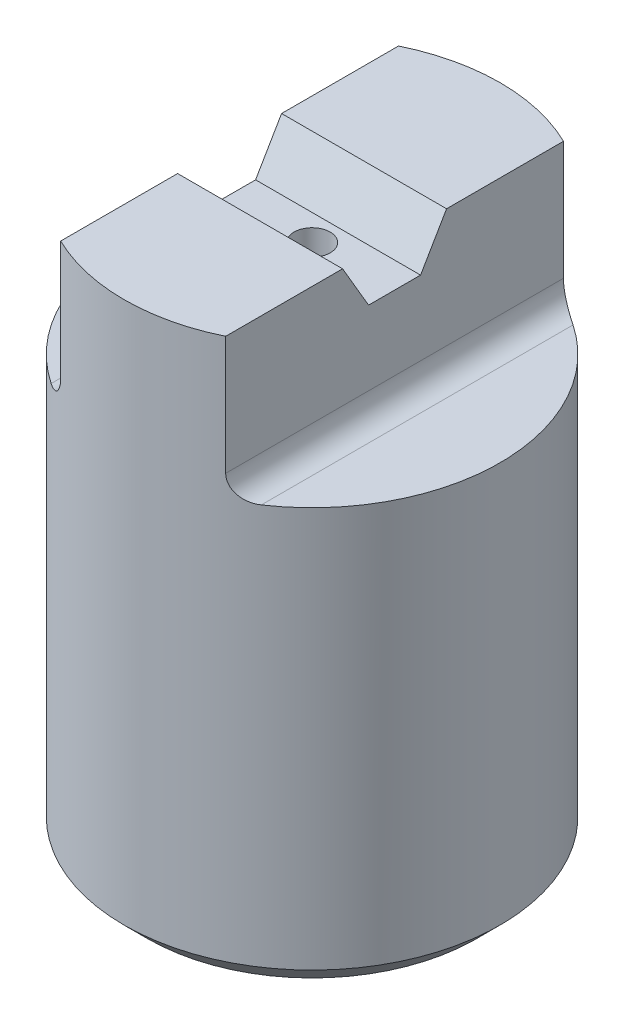
from build123d import *

# Parameters (mm, degrees)
CROQUIS1_R                  = 12.6746
SALIENTE_EXTRUIR2_DEPTH     = 28.575
SALIENTE_EXTRUIR3_DEPTH     = 9.525
CROQUIS6_W                  = 11.1252
CROQUIS6_H                  = 3.5052
CORTAR_EXTRUIR3_DEPTH       = 2.9972
REDONDEO2_R                 = 1.524
CORTAR_EXTRUIR9_DEPTH       = 45.100464428
CORTAR_EXTRUIR10_DEPTH      = 45.100464428
TALADRO_ROSCADO_8_326_D     = 3.4544
TALADRO_ROSCADO_8_326_DEPTH = 20.574
TALADRO_ROSCADO_8_326_TIP   = 1.037806461
CROQUIS40_R                 = 1.2192
CORTAR_EXTRUIR14_DEPTH      = 43.105830748
CORTAR_EXTRUIR15_DEPTH      = 0.0508


with BuildPart() as part:
    # Croquis1 → Saliente-Extruir2 (new body)
    with BuildSketch(Plane(origin=(0, 0, 0), x_dir=(1, 0, 0), z_dir=(0, 1, 0))):
        with Locations(Location((0, 0, 0), (0, 0, 270))):
            Circle(CROQUIS1_R)
    extrude(amount=SALIENTE_EXTRUIR2_DEPTH)

    # Croquis5 → Saliente-Extruir3 (add)
    with BuildSketch(Plane(origin=(0, 28.575, 0), x_dir=(1, 0, 0), z_dir=(0, 1, 0))):
        with BuildLine():
            ThreePointArc((5.5626, 11.388721017), (2.854645491, 12.348946687), (0, 12.6746))
            ThreePointArc((0, 12.6746), (-2.854645491, 12.348946687), (-5.5626, 11.388721017))
            Line((-5.5626, 11.388721017), (-5.5626, -11.388721017))
            ThreePointArc((-5.5626, -11.388721017), (-2.854645491, -12.348946687), (0, -12.6746))
            ThreePointArc((0, -12.6746), (2.854645491, -12.348946687), (5.5626, -11.388721017))
            Line((5.5626, -11.388721017), (5.5626, 11.388721017))
        make_face()
    extrude(amount=SALIENTE_EXTRUIR3_DEPTH)

    # Croquis6 → Cortar-Extruir3 (cut)
    with BuildSketch(Plane(origin=(0, 38.1, 0), x_dir=(1, 0, 0), z_dir=(0, 1, 0))):
        Rectangle(CROQUIS6_W, CROQUIS6_H)
    extrude(amount=-CORTAR_EXTRUIR3_DEPTH, mode=Mode.SUBTRACT)

    # Redondeo2
    # the kernel refuses this fillet: 1.524 mm, written as the material it adds along each edge
    with BuildSketch(Plane(origin=(5.5626, 28.575, 15.198721017), x_dir=(0, 1, 0), z_dir=(0, 0, -1))) as redondeo2_piece_1_section:
        with BuildLine():
            CenterArc((REDONDEO2_R, REDONDEO2_R), REDONDEO2_R, 180, 90)
            Line((0, REDONDEO2_R), (0, 0))
            Line((0, 0), (REDONDEO2_R, 0))
        make_face()
    redondeo2_piece_1 = extrude(amount=30.397442034, mode=Mode.PRIVATE)
    redondeo2_piece_1 = redondeo2_piece_1 & Plane(origin=(0, 28.923095932, 0), x_dir=(0, 0, 1), z_dir=(0, -1, 0)) * Cylinder(12.6746, 67, mode=Mode.PRIVATE)
    add(redondeo2_piece_1)
    with BuildSketch(Plane(origin=(-5.5626, 28.575, -15.198721017), x_dir=(0, 1, 0), z_dir=(0, 0, 1))) as redondeo2_piece_2_section:
        with BuildLine():
            CenterArc((REDONDEO2_R, REDONDEO2_R), REDONDEO2_R, 180, 90)
            Line((0, REDONDEO2_R), (0, 0))
            Line((0, 0), (REDONDEO2_R, 0))
        make_face()
    redondeo2_piece_2 = extrude(amount=30.397442034, mode=Mode.PRIVATE)
    redondeo2_piece_2 = redondeo2_piece_2 & Plane(origin=(0, 28.923095728, 0), x_dir=(0, 0, 1), z_dir=(0, -1, 0)) * Cylinder(12.6746, 67, mode=Mode.PRIVATE)
    add(redondeo2_piece_2)

    # Chaflán1
    # the kernel refuses this chamfer: 1.5748 mm, written as the material it takes off along each edge
    with BuildSketch(Plane(origin=(0, 0, 0), x_dir=(0, 0, 1), z_dir=(-1, 0, 0))) as chafl_n1_piece_1:
        with BuildLine():
            Line((12.71914207, 1.61934207), (11.05525793, -0.04454207))
            Line((11.05525793, -0.04454207), (11.05525793, -0.07603807))
            ThreePointArc((11.05525793, -0.07603807), (11.864928965, -0.031496), (12.6746, -0.031496))
            Line((12.6746, -0.031496), (12.706096, 0))
            ThreePointArc((12.706096, 0), (12.706096, 0.809671035), (12.75063807, 1.61934207))
            Line((12.75063807, 1.61934207), (12.71914207, 1.61934207))
        make_face()
    revolve(axis=Axis((0, 0, 0), (0, 1, 0)), mode=Mode.SUBTRACT)

    # Croquis15 → Cortar-Extruir9 (cut, through all)
    with BuildSketch(Plane(origin=(5.5626, 0, 0), x_dir=(0, 0, -1), z_dir=(1, 0, 0))):
        Polygon((-1.7526, 38.1), (-3.5052, 38.1), (-1.7526, 35.1028), align=None)
    extrude(amount=-CORTAR_EXTRUIR9_DEPTH, mode=Mode.SUBTRACT)

    # Croquis16 → Cortar-Extruir10 (cut, through all)
    with BuildSketch(Plane(origin=(5.5626, 0, 0), x_dir=(0, 0, -1), z_dir=(1, 0, 0))):
        Polygon((1.7526, 38.1), (3.5052, 38.1), (1.7526, 35.1028), align=None)
    extrude(amount=-CORTAR_EXTRUIR10_DEPTH, mode=Mode.SUBTRACT)

    # Taladro roscado #8-326
    with Locations(Plane(origin=(0, 0, 0), x_dir=(-1, 0, 0), z_dir=(0, -1, 0))):
        with Locations((0, 0)):
            Hole(TALADRO_ROSCADO_8_326_D / 2, depth=TALADRO_ROSCADO_8_326_DEPTH)
            with Locations((0, 0, -(TALADRO_ROSCADO_8_326_DEPTH + TALADRO_ROSCADO_8_326_TIP / 2))):  # 118° drill point
                Cone(0, TALADRO_ROSCADO_8_326_D / 2, TALADRO_ROSCADO_8_326_TIP, mode=Mode.SUBTRACT)

    # Croquis40 → Cortar-Extruir14 (cut, through all)
    with BuildSketch(Plane(origin=(0, 0, 0), x_dir=(-1, 0, 0), z_dir=(0, -1, 0))):
        with Locations(Location((0, 0, 0), (0, 0, 90))):
            Circle(CROQUIS40_R)
    extrude(amount=-CORTAR_EXTRUIR14_DEPTH, mode=Mode.SUBTRACT)

    # Croquis41 → Cortar-Extruir15 (cut)
    # profile 1 of 6: a face of its own
    with BuildSketch(Plane.XZ):
        with BuildLine():
            Line((-4.992662026, -3.293411408), (-4.768303051, -3.293411408))
            Line((-4.768303051, -3.293411408), (-4.768303051, -5.390466696))
            add(Edge.make_bspline(
                [(-4.768303051, -5.390466696), (-4.768386411, -5.420148045), (-4.768544599, -5.476473518), (-4.767488008, -5.556630617), (-4.767313328, -5.627924481), (-4.765166457, -5.690534847), (-4.765388336, -5.744330476), (-4.762801871, -5.789411743), (-4.760954184, -5.825653774), (-4.759227779, -5.846899537), (-4.758487346, -5.856011568)],
                knots=[0, 0, 0, 0, 1.52940598, 2.902311409, 4.130712251, 5.202771279, 6.130127115, 6.901697667, 7.528952418, 8, 8, 8, 8], degree=3))
            add(Edge.make_bspline(
                [(-4.758487346, -5.856011568), (-4.755056742, -5.88880782), (-4.748425029, -5.952206373), (-4.7300757, -6.042465908), (-4.70641213, -6.124748397), (-4.676422048, -6.199112019), (-4.638457609, -6.266635032), (-4.592132999, -6.328122409), (-4.535635619, -6.382849035), (-4.473060827, -6.432214804), (-4.405232741, -6.472227698), (-4.335984491, -6.50245132), (-4.266087847, -6.520897884), (-4.219192787, -6.523100238), (-4.196187667, -6.524180638)],
                knots=[0, 0, 0, 0, 1.233978422, 2.385408102, 3.443092075, 4.435883103, 5.380097978, 6.335597085, 7.306989159, 8.316906446, 9.313315333, 10.246232584, 11.139661392, 12, 12, 12, 12], degree=3))
            add(Edge.make_bspline(
                [(-4.196187667, -6.524180638), (-4.176264914, -6.523091954), (-4.136224529, -6.520903936), (-4.07680775, -6.507583995), (-4.019515335, -6.483361432), (-3.963128624, -6.452209128), (-3.910669392, -6.41138045), (-3.861384756, -6.3641374), (-3.818275035, -6.308809383), (-3.77878774, -6.24737984), (-3.743237988, -6.17913208), (-3.714890605, -6.1031862), (-3.688547019, -6.021353301), (-3.677011991, -5.963665416), (-3.671047443, -5.933836087)],
                knots=[0, 0, 0, 0, 0.837480519, 1.683153013, 2.542005906, 3.443313479, 4.382087717, 5.32649414, 6.304899784, 7.320870994, 8.392453742, 9.530326583, 10.722977969, 12, 12, 12, 12], degree=3))
            add(Edge.make_bspline(
                [(-3.671047443, -5.933836087), (-3.669065145, -5.921464707), (-3.664628284, -5.893774578), (-3.660072207, -5.847421191), (-3.655960873, -5.792483488), (-3.652478995, -5.7289004), (-3.649805715, -5.656674316), (-3.647492588, -5.575576925), (-3.64728677, -5.485817851), (-3.646775343, -5.423185178), (-3.64650818, -5.390466696)],
                knots=[0, 0, 0, 0, 0.552253263, 1.236075838, 2.05236972, 2.981084083, 4.043109589, 5.238675865, 6.557520693, 8, 8, 8, 8], degree=3))
            Line((-3.64650818, -5.390466696), (-3.64650818, -3.293411408))
            Line((-3.64650818, -3.293411408), (-3.422149205, -3.293411408))
            Line((-3.422149205, -3.293411408), (-3.422149205, -5.407293619))
            add(Edge.make_bspline(
                [(-3.422149205, -5.407293619), (-3.422145618, -5.44539169), (-3.422138617, -5.51973615), (-3.426101895, -5.628647334), (-3.430953151, -5.731950993), (-3.436718314, -5.829749521), (-3.446287171, -5.921547425), (-3.456501645, -6.008111089), (-3.468987609, -6.089054706), (-3.488259512, -6.188389008), (-3.51985986, -6.305238476), (-3.574075113, -6.436959154), (-3.64504873, -6.558943511), (-3.7155395, -6.65239644), (-3.779060793, -6.719401818), (-3.829714099, -6.762876108), (-3.882291486, -6.800380023), (-3.937465853, -6.83100541), (-3.995521465, -6.854105318), (-4.055871834, -6.871076453), (-4.118969258, -6.881041764), (-4.161797882, -6.882442838), (-4.183567475, -6.883154997)],
                knots=[0, 0, 0, 0, 1.238879896, 2.417546473, 3.543655311, 4.602315735, 5.602851712, 6.544620291, 7.436811699, 8.265563253, 9.834735862, 11.364748224, 12.883467989, 14.412706183, 15.159901872, 15.882054845, 16.580046493, 17.256989577, 17.928793198, 18.607398226, 19.292146902, 20, 20, 20, 20], degree=3))
            add(Edge.make_bspline(
                [(-4.183567475, -6.883154997), (-4.206958879, -6.88235663), (-4.253214246, -6.880777898), (-4.321491122, -6.871991675), (-4.386970123, -6.855204574), (-4.450573247, -6.834041035), (-4.51074344, -6.804644127), (-4.569034859, -6.770479059), (-4.62345849, -6.728369544), (-4.676218004, -6.681758421), (-4.724947655, -6.62913737), (-4.769982839, -6.57219038), (-4.81077525, -6.510979532), (-4.846991367, -6.445659584), (-4.879908637, -6.376627176), (-4.906430232, -6.302792338), (-4.93094096, -6.225559218), (-4.94303647, -6.172087936), (-4.949192475, -6.144873747)],
                knots=[0, 0, 0, 0, 0.971014046, 1.9201332, 2.849222265, 3.772370379, 4.696333185, 5.62273577, 6.571210597, 7.546525356, 8.541459588, 9.542613398, 10.556648516, 11.58997757, 12.639875616, 13.726141058, 14.84272035, 16, 16, 16, 16], degree=3))
            add(Edge.make_bspline(
                [(-4.949192475, -6.144873747), (-4.952953823, -6.126217873), (-4.961140154, -6.08561457), (-4.968532993, -6.018733589), (-4.976803544, -5.941923421), (-4.981666395, -5.854629391), (-4.986880925, -5.757431147), (-4.990178645, -5.649899902), (-4.992311899, -5.532102343), (-4.992542044, -5.450063204), (-4.992662026, -5.407293619)],
                knots=[0, 0, 0, 0, 0.617064475, 1.343000901, 2.181091511, 3.123113956, 4.178235311, 5.338777187, 6.612620808, 8, 8, 8, 8], degree=3))
            Line((-4.992662026, -5.407293619), (-4.992662026, -3.293411408))
        make_face()
    # profile 2 of 6: a face of its own
    with BuildSketch(Plane.XZ):
        Polygon((-3.063174846, -3.652385767), (-3.063174846, -3.293411408), (-1.761892795, -3.293411408), (-1.761892795, -3.652385767), (-2.300354334, -3.652385767), (-2.300354334, -6.793411408), (-2.524713308, -6.793411408), (-2.524713308, -3.652385767), align=None)
    # profile 3 of 6: a face of its own
    with BuildSketch(Plane.XZ):
        with BuildLine():
            Line((-1.268303051, -4.370334485), (-1.492662026, -4.370334485))
            add(Edge.make_bspline(
                [(-1.492662026, -4.370334485), (-1.491249415, -4.328709553), (-1.48848232, -4.247172488), (-1.476698993, -4.127921677), (-1.457543571, -4.014412082), (-1.432613571, -3.906583036), (-1.400974668, -3.80409038), (-1.362572357, -3.707468663), (-1.317441044, -3.616551104), (-1.266690621, -3.531857638), (-1.210443491, -3.4554502), (-1.150844606, -3.388226925), (-1.087899902, -3.331437802), (-1.021800588, -3.284486071), (-0.951742259, -3.248633159), (-0.878841186, -3.222197529), (-0.802512309, -3.206290005), (-0.750481781, -3.204547105), (-0.724232539, -3.203667818)],
                knots=[0, 0, 0, 0, 1.297044685, 2.540718129, 3.729070834, 4.880324332, 5.985502297, 7.066906567, 8.115168262, 9.143861263, 10.138268346, 11.066215908, 11.937346821, 12.773434982, 13.584102209, 14.380791367, 15.183114186, 16, 16, 16, 16], degree=3))
            add(Edge.make_bspline(
                [(-0.724232539, -3.203667818), (-0.698209547, -3.204542868), (-0.647132483, -3.206260388), (-0.57273976, -3.221857793), (-0.501624691, -3.245376516), (-0.434913088, -3.280335692), (-0.371759033, -3.324355215), (-0.312606254, -3.378047283), (-0.257785827, -3.44193545), (-0.207409473, -3.514370967), (-0.16159378, -3.592978513), (-0.121234361, -3.676100948), (-0.08812935, -3.763132571), (-0.059411478, -3.853023745), (-0.038850729, -3.946777118), (-0.023523365, -4.043692817), (-0.01306459, -4.14411241), (-0.012287275, -4.212321568), (-0.011892795, -4.246937049)],
                knots=[0, 0, 0, 0, 0.891761707, 1.750320298, 2.597193173, 3.454252882, 4.323933789, 5.23219579, 6.187107746, 7.205893807, 8.255144488, 9.305864623, 10.371982191, 11.447226411, 12.54040718, 13.66085814, 14.812908365, 16, 16, 16, 16], degree=3))
            add(Edge.make_bspline(
                [(-0.011892795, -4.246937049), (-0.012817305, -4.29561094), (-0.014646394, -4.391909407), (-0.033835804, -4.533757316), (-0.063009006, -4.671298497), (-0.097864153, -4.783467214), (-0.133655696, -4.873754666), (-0.165367856, -4.947326513), (-0.203308608, -5.026230509), (-0.247231634, -5.110961853), (-0.294926044, -5.202290985), (-0.35053538, -5.298055307), (-0.409530423, -5.40082302), (-0.452461982, -5.470281345), (-0.47463318, -5.506151792)],
                knots=[0, 0, 0, 0, 1.28611077, 2.544495465, 3.77696322, 5.000306008, 5.643984437, 6.344138279, 7.117951803, 7.957999182, 8.867353859, 9.841408822, 10.885236111, 12, 12, 12, 12], degree=3))
            Line((-0.47463318, -5.506151792), (-1.054460904, -6.434437049))
            Line((-1.054460904, -6.434437049), (0.032979, -6.434437049))
            Line((0.032979, -6.434437049), (0.032979, -6.793411408))
            Line((0.032979, -6.793411408), (-1.582405616, -6.793411408))
            Line((-1.582405616, -6.793411408), (-0.677257378, -5.344893779))
            add(Edge.make_bspline(
                [(-0.677257378, -5.344893779), (-0.655172914, -5.310377804), (-0.612673104, -5.243954534), (-0.553216932, -5.146959205), (-0.499024331, -5.057468712), (-0.451184706, -4.974437499), (-0.409356518, -4.898464623), (-0.373010997, -4.829545011), (-0.343751073, -4.767126648), (-0.311675423, -4.693602158), (-0.280782085, -4.604391412), (-0.254939808, -4.496136477), (-0.238816495, -4.385077693), (-0.237113083, -4.310092791), (-0.236251769, -4.272177433)],
                knots=[0, 0, 0, 0, 1.252259667, 2.409874896, 3.476769317, 4.449496393, 5.338169355, 6.127231762, 6.830129708, 7.444415217, 8.578321592, 9.709547945, 10.841856079, 12, 12, 12, 12], degree=3))
            add(Edge.make_bspline(
                [(-0.236251769, -4.272177433), (-0.236571083, -4.248318482), (-0.237198647, -4.201427152), (-0.244652469, -4.132597353), (-0.255546455, -4.066188424), (-0.271975767, -4.002322496), (-0.291986039, -3.940801545), (-0.316800398, -3.881912397), (-0.346362636, -3.825627573), (-0.380267376, -3.772494039), (-0.417051494, -3.72348066), (-0.456199915, -3.680676294), (-0.497288897, -3.64403349), (-0.540901234, -3.61482514), (-0.586198647, -3.590774364), (-0.634159981, -3.575101246), (-0.683824755, -3.564700448), (-0.717635349, -3.563333891), (-0.734749366, -3.562642177)],
                knots=[0, 0, 0, 0, 1.195946325, 2.350460179, 3.467975454, 4.568023639, 5.653933819, 6.709635605, 7.768585112, 8.838246342, 9.867263882, 10.837753356, 11.742920911, 12.620583845, 13.464497734, 14.305803424, 15.142443115, 16, 16, 16, 16], degree=3))
            add(Edge.make_bspline(
                [(-0.734749366, -3.562642177), (-0.752784309, -3.563368062), (-0.788421919, -3.564802433), (-0.840668399, -3.574634746), (-0.890265244, -3.591858665), (-0.937591645, -3.615198666), (-0.982902713, -3.644960927), (-1.025877045, -3.681602152), (-1.065661734, -3.725673908), (-1.103525209, -3.775191471), (-1.137810734, -3.830951352), (-1.168780797, -3.89205452), (-1.19523593, -3.958779315), (-1.217531928, -4.030821731), (-1.236638652, -4.108020499), (-1.250828291, -4.190787664), (-1.262496757, -4.278698079), (-1.266331375, -4.339216979), (-1.268303051, -4.370334485)],
                knots=[0, 0, 0, 0, 0.810378014, 1.601332232, 2.378500311, 3.162873048, 3.966828608, 4.808649696, 5.693150465, 6.629974261, 7.60629017, 8.630194302, 9.704767081, 10.827479045, 12.017020653, 13.275760701, 14.599255253, 16, 16, 16, 16], degree=3))
        make_face()
    # profile 4 of 6: a face of its own
    with BuildSketch(Plane.XZ):
        with BuildLine():
            add(Edge.make_bspline(
                [(0.257337974, -5.044813651), (0.25751588, -4.988719007), (0.257861389, -4.87977841), (0.263139742, -4.721070025), (0.270337847, -4.572115557), (0.281708481, -4.433029668), (0.295590095, -4.30395689), (0.312100725, -4.184603362), (0.332219221, -4.075058212), (0.356219641, -3.974750975), (0.383311598, -3.882318426), (0.411561519, -3.795960636), (0.443500662, -3.715588001), (0.477329378, -3.640622198), (0.514884698, -3.5718501), (0.553671735, -3.50830757), (0.596372038, -3.451439347), (0.640037626, -3.399342379), (0.686670897, -3.353506267), (0.734833361, -3.313748308), (0.784222016, -3.279288145), (0.835609245, -3.252328032), (0.887704531, -3.229991685), (0.941391026, -3.214620213), (0.996444261, -3.205095648), (1.033674975, -3.204145798), (1.05241009, -3.203667818)],
                knots=[0, 0, 0, 0, 1.840611924, 3.574625809, 5.210288994, 6.733690746, 8.153088898, 9.469738415, 10.686590807, 11.806362567, 12.852408481, 13.84671381, 14.786621783, 15.689150017, 16.543575688, 17.356484395, 18.129528257, 18.874838159, 19.585241281, 20.271601602, 20.922514328, 21.557232885, 22.17251978, 22.77928835, 23.385717578, 24, 24, 24, 24], degree=3))
            add(Edge.make_bspline(
                [(1.05241009, -3.203667818), (1.071377234, -3.204148623), (1.109069173, -3.205104089), (1.164836676, -3.214586007), (1.219361714, -3.230167809), (1.272414117, -3.251945044), (1.324204921, -3.279508148), (1.374161036, -3.313732597), (1.423344605, -3.353432542), (1.470024877, -3.400325704), (1.516265246, -3.452001715), (1.55840441, -3.51137143), (1.599271062, -3.57576602), (1.637311577, -3.646587745), (1.672624806, -3.723574276), (1.706556701, -3.806453767), (1.73722362, -3.895690937), (1.76532749, -3.991367231), (1.790509585, -4.09430737), (1.81324814, -4.205055445), (1.830803204, -4.32452442), (1.846436378, -4.452130021), (1.858247611, -4.588469726), (1.866188484, -4.733212317), (1.872382597, -4.886307513), (1.872607276, -4.991054114), (1.87272259, -5.044813651)],
                knots=[0, 0, 0, 0, 0.61931987, 1.230726449, 1.842276086, 2.469083849, 3.101126489, 3.755607413, 4.444978797, 5.163186422, 5.915344883, 6.708120043, 7.538652771, 8.406543624, 9.332465898, 10.305288366, 11.331696478, 12.414266268, 13.562606502, 14.793690034, 16.107010801, 17.506992722, 18.994173924, 20.577607932, 22.243511351, 24, 24, 24, 24], degree=3))
            add(Edge.make_bspline(
                [(1.87272259, -5.044813651), (1.872600301, -5.098338932), (1.872362059, -5.202617197), (1.866266295, -5.355019424), (1.857984009, -5.499013325), (1.847346938, -5.634728866), (1.831543029, -5.761612642), (1.813621431, -5.880488328), (1.792213178, -5.990988722), (1.766714861, -6.093359103), (1.738510511, -6.188214081), (1.708508428, -6.27702139), (1.675532231, -6.359874832), (1.640051809, -6.437064451), (1.601397402, -6.507888004), (1.560681687, -6.572951928), (1.517302127, -6.631761828), (1.471769971, -6.684709167), (1.423767962, -6.730955933), (1.375153409, -6.771804317), (1.324559981, -6.80597468), (1.272908931, -6.833924147), (1.219699484, -6.856297846), (1.164951114, -6.871167001), (1.109155354, -6.881973837), (1.071392886, -6.882759868), (1.05241009, -6.883154997)],
                knots=[0, 0, 0, 0, 1.751203978, 3.411705794, 4.989635015, 6.470547094, 7.864820227, 9.172348517, 10.403592363, 11.546053707, 12.622745216, 13.64081562, 14.612090724, 15.539258073, 16.418683361, 17.250332895, 18.048691368, 18.807623264, 19.532264191, 20.2274163, 20.882777295, 21.526025529, 22.146602355, 22.76633056, 23.379847339, 24, 24, 24, 24], degree=3))
            add(Edge.make_bspline(
                [(1.05241009, -6.883154997), (1.033676694, -6.882672709), (0.996449398, -6.881714298), (0.941370777, -6.872253324), (0.887866643, -6.856664547), (0.835772035, -6.835422159), (0.784633039, -6.808798772), (0.735809604, -6.774656381), (0.688011402, -6.735242916), (0.64148994, -6.690285189), (0.597490078, -6.639053655), (0.555936475, -6.581735979), (0.516694711, -6.518411778), (0.479871414, -6.449252173), (0.445171792, -6.374459763), (0.413925453, -6.29348534), (0.384472903, -6.206764877), (0.35771383, -6.113440139), (0.333563132, -6.012475081), (0.313677956, -5.902155127), (0.296300756, -5.782412528), (0.281549459, -5.653368027), (0.270389167, -5.514702849), (0.263123571, -5.366455725), (0.257872712, -5.208680015), (0.2575195, -5.100440728), (0.257337974, -5.044813651)],
                knots=[0, 0, 0, 0, 0.615040495, 1.222218104, 1.829735474, 2.442855763, 3.067974884, 3.719690887, 4.39608901, 5.102002169, 5.842401988, 6.611854182, 7.425766082, 8.28800789, 9.184674408, 10.132888609, 11.13814523, 12.192858638, 13.321481046, 14.547385015, 15.874351835, 17.296351847, 18.813980256, 20.44399383, 22.172472907, 24, 24, 24, 24], degree=3))
        make_face()
        with BuildLine():
            add(Edge.make_bspline(
                [(0.481696949, -5.043411408), (0.482080465, -5.090153658), (0.482824551, -5.18084137), (0.485284048, -5.312689585), (0.49066077, -5.435680733), (0.499454256, -5.549701042), (0.508974712, -5.654942304), (0.52052191, -5.751608412), (0.535241457, -5.839303965), (0.557105426, -5.941794243), (0.589529079, -6.056130948), (0.637425005, -6.178825013), (0.694706469, -6.283501628), (0.76003588, -6.369927239), (0.83055099, -6.43797079), (0.904383194, -6.486775747), (0.980817188, -6.518308419), (1.033435968, -6.522239371), (1.059421307, -6.524180638)],
                knots=[0, 0, 0, 0, 1.299996472, 2.52220861, 3.667329456, 4.723158737, 5.702344579, 6.606077473, 7.429920264, 8.174407715, 9.519852493, 10.730430039, 11.830159776, 12.827237725, 13.732931806, 14.540564911, 15.279270345, 16, 16, 16, 16], degree=3))
            add(Edge.make_bspline(
                [(1.059421307, -6.524180638), (1.085406166, -6.522506834), (1.138272194, -6.519101489), (1.214343992, -6.487784102), (1.28758995, -6.440157054), (1.343801729, -6.38594601), (1.386308534, -6.333819744), (1.418547842, -6.289728058), (1.446471977, -6.239461576), (1.474275405, -6.185828783), (1.498581032, -6.126726862), (1.521821784, -6.063505613), (1.541918758, -5.994949761), (1.553869316, -5.947664766), (1.560022269, -5.92331926)],
                knots=[0, 0, 0, 0, 1.109016766, 2.256287439, 3.472688268, 4.83954039, 5.579231321, 6.354392292, 7.175278167, 8.039473, 8.941357723, 9.910535225, 10.924202583, 12, 12, 12, 12], degree=3))
            add(Edge.make_bspline(
                [(1.560022269, -5.92331926), (1.567345783, -5.892066827), (1.582254008, -5.828447329), (1.599142653, -5.729773866), (1.614737803, -5.626973847), (1.627552583, -5.519442715), (1.63612699, -5.407133688), (1.643378311, -5.290049325), (1.647569729, -5.168241744), (1.648096059, -5.085481748), (1.648363615, -5.043411408)],
                knots=[0, 0, 0, 0, 0.868982443, 1.768957519, 2.709576121, 3.684481657, 4.700344323, 5.759061376, 6.860837897, 8, 8, 8, 8], degree=3))
            add(Edge.make_bspline(
                [(1.648363615, -5.043411408), (1.648033549, -5.001342698), (1.647387971, -4.919060499), (1.644135903, -4.79865063), (1.637567958, -4.684130682), (1.629548871, -4.575367033), (1.618129774, -4.472537568), (1.605143453, -4.375415643), (1.588859409, -4.284271606), (1.570747377, -4.198654023), (1.550610033, -4.118833029), (1.528087462, -4.04467301), (1.503465782, -3.976248246), (1.478090055, -3.91255796), (1.448811878, -3.855543142), (1.419900952, -3.802775216), (1.387415448, -3.756687203), (1.343738706, -3.703684508), (1.286413403, -3.64911283), (1.214037121, -3.598853666), (1.137344288, -3.568854876), (1.085130448, -3.564691934), (1.059421307, -3.562642177)],
                knots=[0, 0, 0, 0, 1.462853938, 2.861196328, 4.18782769, 5.451198954, 6.652844536, 7.784875945, 8.857723185, 9.87141619, 10.827338558, 11.719363824, 12.565023905, 13.355800326, 14.100824753, 14.792290922, 15.44605478, 16.057864784, 17.178757343, 18.186242339, 19.106938872, 20, 20, 20, 20], degree=3))
            add(Edge.make_bspline(
                [(1.059421307, -3.562642177), (1.033478289, -3.564688958), (0.980809686, -3.568844262), (0.903462116, -3.598849847), (0.830344231, -3.648850984), (0.76009185, -3.716341622), (0.694224255, -3.801611625), (0.639380309, -3.907225257), (0.589841028, -4.029018994), (0.557893743, -4.143656785), (0.535871551, -4.246103262), (0.521517208, -4.333646931), (0.508593607, -4.430167161), (0.499556707, -4.535733293), (0.490684011, -4.649972863), (0.485255913, -4.773198011), (0.482830361, -4.905280412), (0.482082402, -4.996435466), (0.481696949, -5.043411408)],
                knots=[0, 0, 0, 0, 0.720594395, 1.462925345, 2.273981384, 3.170318304, 4.162048865, 5.255332532, 6.468105352, 7.81329763, 8.557645363, 9.381333542, 10.279270897, 11.264743477, 12.326855401, 13.465269645, 14.693749385, 16, 16, 16, 16], degree=3))
        make_face(mode=Mode.SUBTRACT)
    # profile 5 of 6: a face of its own
    with BuildSketch(Plane.XZ):
        with BuildLine():
            Line((2.411184128, -4.101103715), (2.186825154, -4.101103715))
            add(Edge.make_bspline(
                [(2.186825154, -4.101103715), (2.192505495, -4.065973237), (2.203544316, -3.997702852), (2.226278863, -3.898968877), (2.252811658, -3.806545282), (2.282865302, -3.720107025), (2.316453154, -3.63994448), (2.353745491, -3.565807762), (2.394672689, -3.497618191), (2.440687069, -3.43668779), (2.488585336, -3.381878273), (2.539442949, -3.334559206), (2.592222928, -3.294294549), (2.647022881, -3.260923084), (2.704571973, -3.23537806), (2.764178573, -3.217406501), (2.825771639, -3.205420688), (2.867558256, -3.20425576), (2.88864807, -3.203667818)],
                knots=[0, 0, 0, 0, 1.375500198, 2.673061445, 3.914154514, 5.091447837, 6.209049737, 7.271761046, 8.297573281, 9.278805903, 10.219733474, 11.108365601, 11.95950585, 12.78231147, 13.583195793, 14.386319503, 15.185571241, 16, 16, 16, 16], degree=3))
            add(Edge.make_bspline(
                [(2.88864807, -3.203667818), (2.919422347, -3.205082823), (2.980973573, -3.207912955), (3.071073715, -3.233139973), (3.157752213, -3.2731094), (3.24013375, -3.32790973), (3.316265809, -3.39614057), (3.385018946, -3.475503943), (3.442270096, -3.567425361), (3.490892994, -3.667862244), (3.529977255, -3.774712134), (3.556933218, -3.885539007), (3.574757279, -3.998397843), (3.576814564, -4.074627006), (3.577850795, -4.113022786)],
                knots=[0, 0, 0, 0, 0.877359105, 1.754794358, 2.650690736, 3.594712977, 4.568509496, 5.562406947, 6.582555176, 7.651131429, 8.744757127, 9.824405285, 10.904177203, 12, 12, 12, 12], degree=3))
            add(Edge.make_bspline(
                [(3.577850795, -4.113022786), (3.577143702, -4.149991622), (3.575764879, -4.222080463), (3.562090941, -4.327253054), (3.539862217, -4.426658149), (3.50821149, -4.520126237), (3.468094953, -4.607962381), (3.418789867, -4.689623735), (3.360334889, -4.765578825), (3.314778389, -4.810440269), (3.291793102, -4.833074869)],
                knots=[0, 0, 0, 0, 1.110944838, 2.16633074, 3.182222826, 4.16875185, 5.127645918, 6.079590169, 7.031067565, 8, 8, 8, 8], degree=3))
            add(Edge.make_bspline(
                [(3.291793102, -4.833074869), (3.318818867, -4.851223499), (3.373340275, -4.887836297), (3.444898918, -4.958125588), (3.509584746, -5.039349805), (3.544958226, -5.100396906), (3.563127237, -5.131752754)],
                knots=[0, 0, 0, 0, 0.955545385, 1.92770423, 2.935599049, 4, 4, 4, 4], degree=3))
            add(Edge.make_bspline(
                [(3.563127237, -5.131752754), (3.575195189, -5.154945048), (3.59941048, -5.201482203), (3.628810253, -5.274542773), (3.655384187, -5.349171913), (3.676141785, -5.426111566), (3.692204885, -5.505066821), (3.704301938, -5.586006252), (3.711400373, -5.669150085), (3.71210932, -5.725355838), (3.712466179, -5.753647786)],
                knots=[0, 0, 0, 0, 0.970436241, 1.947256364, 2.921759913, 3.911414579, 4.903844001, 5.91287372, 6.949415926, 8, 8, 8, 8], degree=3))
            add(Edge.make_bspline(
                [(3.712466179, -5.753647786), (3.711102825, -5.802567006), (3.70839689, -5.899660074), (3.687144365, -6.043525371), (3.653989461, -6.184144376), (3.606249964, -6.318926508), (3.548717591, -6.444974418), (3.47970283, -6.557902202), (3.40018397, -6.655348432), (3.311612291, -6.737258109), (3.21532275, -6.802951549), (3.111524697, -6.848364239), (3.002733359, -6.878369935), (2.927875296, -6.881548767), (2.890050314, -6.883154997)],
                knots=[0, 0, 0, 0, 1.137687875, 2.258041034, 3.376373692, 4.494124616, 5.579086693, 6.594632821, 7.564433768, 8.495651269, 9.392931365, 10.261890273, 11.121751674, 12, 12, 12, 12], degree=3))
            add(Edge.make_bspline(
                [(2.890050314, -6.883154997), (2.864535013, -6.882300496), (2.814389025, -6.880621118), (2.740550641, -6.868688912), (2.670320603, -6.847364522), (2.603127514, -6.81829443), (2.538876079, -6.781786946), (2.478235717, -6.736465311), (2.421252121, -6.682510155), (2.367309675, -6.620904488), (2.317526926, -6.551038064), (2.271876061, -6.473712469), (2.231169294, -6.38851309), (2.196041247, -6.29555298), (2.163180174, -6.195677945), (2.136394085, -6.087808709), (2.113776097, -5.97218802), (2.102761526, -5.892300092), (2.097081564, -5.851103715)],
                knots=[0, 0, 0, 0, 0.85583928, 1.682006629, 2.500512869, 3.311702452, 4.133393917, 4.973833608, 5.844623799, 6.761352128, 7.716465574, 8.718160193, 9.770134925, 10.879552414, 12.049769242, 13.295223006, 14.605208397, 16, 16, 16, 16], degree=3))
            Line((2.097081564, -5.851103715), (2.321440538, -5.851103715))
            add(Edge.make_bspline(
                [(2.321440538, -5.851103715), (2.326876864, -5.87801729), (2.337408741, -5.930157362), (2.355539466, -6.005321574), (2.375595055, -6.074686322), (2.398224164, -6.137974992), (2.421953787, -6.195611325), (2.447085334, -6.247799295), (2.474030001, -6.29421855), (2.494599881, -6.321727217), (2.504433327, -6.334877754)],
                knots=[0, 0, 0, 0, 1.262847537, 2.446533554, 3.555471567, 4.582277293, 5.536519786, 6.421134418, 7.245222226, 8, 8, 8, 8], degree=3))
            add(Edge.make_bspline(
                [(2.504433327, -6.334877754), (2.517205335, -6.349902488), (2.542310382, -6.379435561), (2.584858211, -6.417958246), (2.62944866, -6.451578807), (2.677967585, -6.477046318), (2.727813433, -6.498882274), (2.780990674, -6.513191006), (2.836412634, -6.522824847), (2.874349464, -6.523724943), (2.893555923, -6.524180638)],
                knots=[0, 0, 0, 0, 1.05425535, 2.072276296, 3.065406793, 4.033653238, 4.997689897, 5.971815539, 6.973181414, 8, 8, 8, 8], degree=3))
            add(Edge.make_bspline(
                [(2.893555923, -6.524180638), (2.915576, -6.523563253), (2.958709063, -6.522353915), (3.021402898, -6.511221628), (3.081109116, -6.494966421), (3.13668693, -6.469557118), (3.190023135, -6.438999162), (3.238899689, -6.399812338), (3.284966781, -6.354684107), (3.326636243, -6.302860553), (3.363690497, -6.246253989), (3.398026348, -6.187850032), (3.4249944, -6.125849818), (3.448626671, -6.062397477), (3.46564797, -5.995777511), (3.479646485, -5.927339051), (3.486087042, -5.856133004), (3.4874282, -5.808109493), (3.488107205, -5.783796023)],
                knots=[0, 0, 0, 0, 0.997751748, 1.954402311, 2.880379547, 3.796231174, 4.717891192, 5.661475619, 6.62834741, 7.638131149, 8.66998115, 9.695441927, 10.706004176, 11.732012594, 12.762991193, 13.821074299, 14.896847751, 16, 16, 16, 16], degree=3))
            add(Edge.make_bspline(
                [(3.488107205, -5.783796023), (3.487245083, -5.751245613), (3.485535678, -5.686705003), (3.469402514, -5.591758972), (3.444281246, -5.500023462), (3.409203749, -5.412912133), (3.366678575, -5.331840965), (3.315323426, -5.260653724), (3.257176831, -5.200025091), (3.202444078, -5.15801293), (3.153834704, -5.130104137), (3.112954037, -5.110870766), (3.066880784, -5.095243308), (3.016660639, -5.080425396), (2.96162702, -5.067868664), (2.90194635, -5.057463474), (2.837611016, -5.049068577), (2.793080003, -5.04533381), (2.770158487, -5.043411408)],
                knots=[0, 0, 0, 0, 1.34076997, 2.658464524, 3.957967947, 5.254933589, 6.522038329, 7.72257434, 8.860361428, 9.974034444, 10.552372612, 11.168698395, 11.83292926, 12.555450681, 13.326621727, 14.158131963, 15.051932463, 16, 16, 16, 16], degree=3))
            Line((2.770158487, -5.043411408), (2.770158487, -4.684437049))
            add(Edge.make_bspline(
                [(2.770158487, -4.684437049), (2.798297794, -4.683670001), (2.853891315, -4.682154581), (2.934716699, -4.664814078), (3.012495115, -4.640094949), (3.084408607, -4.60337064), (3.150127643, -4.559869076), (3.206847429, -4.509473725), (3.254709337, -4.454064453), (3.291157842, -4.391868609), (3.319012906, -4.326207341), (3.338776442, -4.257200411), (3.350999305, -4.185438849), (3.352653712, -4.136441942), (3.35349182, -4.111620542)],
                knots=[0, 0, 0, 0, 1.10421971, 2.181555554, 3.236051397, 4.304183444, 5.343687985, 6.326269505, 7.277830125, 8.208906363, 9.147340148, 10.074783968, 11.024702548, 12, 12, 12, 12], degree=3))
            add(Edge.make_bspline(
                [(3.35349182, -4.111620542), (3.35192564, -4.075476455), (3.348866748, -4.004883768), (3.323402757, -3.903144433), (3.282587359, -3.808809541), (3.233984461, -3.738602399), (3.190018085, -3.68740791), (3.153835745, -3.653907964), (3.115206602, -3.626162114), (3.07497514, -3.602208904), (3.031995376, -3.585093811), (2.98718217, -3.572145469), (2.940098306, -3.564359738), (2.907840552, -3.563220796), (2.891452557, -3.562642177)],
                knots=[0, 0, 0, 0, 1.629228931, 3.182032171, 4.702766143, 6.244460712, 7.014423531, 7.745932124, 8.463235315, 9.157926307, 9.853257568, 10.544335998, 11.26047505, 12, 12, 12, 12], degree=3))
            add(Edge.make_bspline(
                [(2.891452557, -3.562642177), (2.865073133, -3.563998652), (2.813341341, -3.566658788), (2.739127844, -3.591714372), (2.669873158, -3.629653902), (2.618569182, -3.675246181), (2.58111195, -3.719539701), (2.55307409, -3.758112707), (2.526060792, -3.802034856), (2.501460861, -3.851919452), (2.476687815, -3.906469504), (2.453779084, -3.966552333), (2.431079781, -4.031649275), (2.417966425, -4.077427154), (2.411184128, -4.101103715)],
                knots=[0, 0, 0, 0, 1.213912982, 2.380563471, 3.57807147, 4.839367027, 5.520291779, 6.253860538, 7.038248071, 7.896919104, 8.819095369, 9.802630708, 10.863508975, 12, 12, 12, 12], degree=3))
        make_face()
    # profile 6 of 6: a face of its own
    with BuildSketch(Plane.XZ):
        with BuildLine():
            Line((4.250927718, -4.101103715), (4.026568743, -4.101103715))
            add(Edge.make_bspline(
                [(4.026568743, -4.101103715), (4.032249084, -4.065973237), (4.043287906, -3.997702852), (4.066022453, -3.898968877), (4.092555248, -3.806545282), (4.122608892, -3.720107025), (4.156196744, -3.63994448), (4.193489081, -3.565807762), (4.234416278, -3.497618191), (4.280430659, -3.43668779), (4.328328926, -3.381878273), (4.379186539, -3.334559206), (4.431966518, -3.294294549), (4.486766471, -3.260923084), (4.544315563, -3.23537806), (4.603922163, -3.217406501), (4.665515229, -3.205420688), (4.707301846, -3.20425576), (4.72839166, -3.203667818)],
                knots=[0, 0, 0, 0, 1.375500198, 2.673061445, 3.914154514, 5.091447837, 6.209049737, 7.271761046, 8.297573281, 9.278805903, 10.219733474, 11.108365601, 11.95950585, 12.78231147, 13.583195793, 14.386319503, 15.185571241, 16, 16, 16, 16], degree=3))
            add(Edge.make_bspline(
                [(4.72839166, -3.203667818), (4.759165937, -3.205082823), (4.820717162, -3.207912955), (4.910817305, -3.233139973), (4.997495803, -3.2731094), (5.07987734, -3.32790973), (5.156009399, -3.39614057), (5.224762536, -3.475503943), (5.282013685, -3.567425361), (5.330636584, -3.667862244), (5.369720845, -3.774712134), (5.396676808, -3.885539007), (5.414500869, -3.998397843), (5.416558153, -4.074627006), (5.417594384, -4.113022786)],
                knots=[0, 0, 0, 0, 0.877359105, 1.754794358, 2.650690736, 3.594712977, 4.568509496, 5.562406947, 6.582555176, 7.651131429, 8.744757127, 9.824405285, 10.904177203, 12, 12, 12, 12], degree=3))
            add(Edge.make_bspline(
                [(5.417594384, -4.113022786), (5.416887292, -4.149991622), (5.415508469, -4.222080463), (5.401834531, -4.327253054), (5.379605807, -4.426658149), (5.347955079, -4.520126237), (5.307838543, -4.607962381), (5.258533457, -4.689623735), (5.200078478, -4.765578825), (5.154521979, -4.810440269), (5.131536692, -4.833074869)],
                knots=[0, 0, 0, 0, 1.110944838, 2.16633074, 3.182222826, 4.16875185, 5.127645918, 6.079590169, 7.031067565, 8, 8, 8, 8], degree=3))
            add(Edge.make_bspline(
                [(5.131536692, -4.833074869), (5.158562456, -4.851223499), (5.213083864, -4.887836297), (5.284642507, -4.958125588), (5.349328336, -5.039349805), (5.384701816, -5.100396906), (5.402870827, -5.131752754)],
                knots=[0, 0, 0, 0, 0.955545385, 1.92770423, 2.935599049, 4, 4, 4, 4], degree=3))
            add(Edge.make_bspline(
                [(5.402870827, -5.131752754), (5.414938779, -5.154945048), (5.43915407, -5.201482203), (5.468553843, -5.274542773), (5.495127776, -5.349171913), (5.515885375, -5.426111566), (5.531948475, -5.505066821), (5.544045528, -5.586006252), (5.551143962, -5.669150085), (5.55185291, -5.725355838), (5.552209769, -5.753647786)],
                knots=[0, 0, 0, 0, 0.970436241, 1.947256364, 2.921759913, 3.911414579, 4.903844001, 5.91287372, 6.949415926, 8, 8, 8, 8], degree=3))
            add(Edge.make_bspline(
                [(5.552209769, -5.753647786), (5.550846415, -5.802567006), (5.54814048, -5.899660074), (5.526887955, -6.043525371), (5.493733051, -6.184144376), (5.445993554, -6.318926508), (5.388461181, -6.444974418), (5.31944642, -6.557902202), (5.23992756, -6.655348432), (5.151355881, -6.737258109), (5.055066339, -6.802951549), (4.951268287, -6.848364239), (4.842476949, -6.878369935), (4.767618886, -6.881548767), (4.729793904, -6.883154997)],
                knots=[0, 0, 0, 0, 1.137687875, 2.258041034, 3.376373692, 4.494124616, 5.579086693, 6.594632821, 7.564433768, 8.495651269, 9.392931365, 10.261890273, 11.121751674, 12, 12, 12, 12], degree=3))
            add(Edge.make_bspline(
                [(4.729793904, -6.883154997), (4.704278602, -6.882300496), (4.654132615, -6.880621118), (4.580294231, -6.868688912), (4.510064193, -6.847364522), (4.442871103, -6.81829443), (4.378619669, -6.781786946), (4.317979307, -6.736465311), (4.26099571, -6.682510155), (4.207053265, -6.620904488), (4.157270516, -6.551038064), (4.111619651, -6.473712469), (4.070912884, -6.38851309), (4.035784837, -6.29555298), (4.002923764, -6.195677945), (3.976137675, -6.087808709), (3.953519687, -5.97218802), (3.942505116, -5.892300092), (3.936825154, -5.851103715)],
                knots=[0, 0, 0, 0, 0.85583928, 1.682006629, 2.500512869, 3.311702452, 4.133393917, 4.973833608, 5.844623799, 6.761352128, 7.716465574, 8.718160193, 9.770134925, 10.879552414, 12.049769242, 13.295223006, 14.605208397, 16, 16, 16, 16], degree=3))
            Line((3.936825154, -5.851103715), (4.161184128, -5.851103715))
            add(Edge.make_bspline(
                [(4.161184128, -5.851103715), (4.166620454, -5.87801729), (4.177152331, -5.930157362), (4.195283055, -6.005321574), (4.215338645, -6.074686322), (4.237967754, -6.137974992), (4.261697377, -6.195611325), (4.286828924, -6.247799295), (4.313773591, -6.29421855), (4.334343471, -6.321727217), (4.344176916, -6.334877754)],
                knots=[0, 0, 0, 0, 1.262847537, 2.446533554, 3.555471567, 4.582277293, 5.536519786, 6.421134418, 7.245222226, 8, 8, 8, 8], degree=3))
            add(Edge.make_bspline(
                [(4.344176916, -6.334877754), (4.356948925, -6.349902488), (4.382053972, -6.379435561), (4.424601801, -6.417958246), (4.469192249, -6.451578807), (4.517711175, -6.477046318), (4.567557022, -6.498882274), (4.620734264, -6.513191006), (4.676156224, -6.522824847), (4.714093054, -6.523724943), (4.733299513, -6.524180638)],
                knots=[0, 0, 0, 0, 1.05425535, 2.072276296, 3.065406793, 4.033653238, 4.997689897, 5.971815539, 6.973181414, 8, 8, 8, 8], degree=3))
            add(Edge.make_bspline(
                [(4.733299513, -6.524180638), (4.755319589, -6.523563253), (4.798452652, -6.522353915), (4.861146488, -6.511221628), (4.920852706, -6.494966421), (4.976430519, -6.469557118), (5.029766725, -6.438999162), (5.078643279, -6.399812338), (5.124710371, -6.354684107), (5.166379833, -6.302860553), (5.203434086, -6.246253989), (5.237769937, -6.187850032), (5.26473799, -6.125849818), (5.288370261, -6.062397477), (5.30539156, -5.995777511), (5.319390075, -5.927339051), (5.325830631, -5.856133004), (5.32717179, -5.808109493), (5.327850795, -5.783796023)],
                knots=[0, 0, 0, 0, 0.997751748, 1.954402311, 2.880379547, 3.796231174, 4.717891192, 5.661475619, 6.62834741, 7.638131149, 8.66998115, 9.695441927, 10.706004176, 11.732012594, 12.762991193, 13.821074299, 14.896847751, 16, 16, 16, 16], degree=3))
            add(Edge.make_bspline(
                [(5.327850795, -5.783796023), (5.326988673, -5.751245613), (5.325279268, -5.686705003), (5.309146104, -5.591758972), (5.284024836, -5.500023462), (5.248947338, -5.412912133), (5.206422164, -5.331840965), (5.155067016, -5.260653724), (5.096920421, -5.200025091), (5.042187668, -5.15801293), (4.993578294, -5.130104137), (4.952697627, -5.110870766), (4.906624374, -5.095243308), (4.856404229, -5.080425396), (4.80137061, -5.067868664), (4.741689939, -5.057463474), (4.677354606, -5.049068577), (4.632823593, -5.04533381), (4.609902077, -5.043411408)],
                knots=[0, 0, 0, 0, 1.34076997, 2.658464524, 3.957967947, 5.254933589, 6.522038329, 7.72257434, 8.860361428, 9.974034444, 10.552372612, 11.168698395, 11.83292926, 12.555450681, 13.326621727, 14.158131963, 15.051932463, 16, 16, 16, 16], degree=3))
            Line((4.609902077, -5.043411408), (4.609902077, -4.684437049))
            add(Edge.make_bspline(
                [(4.609902077, -4.684437049), (4.638041384, -4.683670001), (4.693634904, -4.682154581), (4.774460289, -4.664814078), (4.852238704, -4.640094949), (4.924152197, -4.60337064), (4.989871232, -4.559869076), (5.046591018, -4.509473725), (5.094452927, -4.454064453), (5.130901432, -4.391868609), (5.158756495, -4.326207341), (5.178520032, -4.257200411), (5.190742894, -4.185438849), (5.192397302, -4.136441942), (5.19323541, -4.111620542)],
                knots=[0, 0, 0, 0, 1.10421971, 2.181555554, 3.236051397, 4.304183444, 5.343687985, 6.326269505, 7.277830125, 8.208906363, 9.147340148, 10.074783968, 11.024702548, 12, 12, 12, 12], degree=3))
            add(Edge.make_bspline(
                [(5.19323541, -4.111620542), (5.19166923, -4.075476455), (5.188610338, -4.004883768), (5.163146347, -3.903144433), (5.122330949, -3.808809541), (5.073728051, -3.738602399), (5.029761675, -3.68740791), (4.993579335, -3.653907964), (4.954950192, -3.626162114), (4.91471873, -3.602208904), (4.871738966, -3.585093811), (4.82692576, -3.572145469), (4.779841895, -3.564359738), (4.747584142, -3.563220796), (4.731196147, -3.562642177)],
                knots=[0, 0, 0, 0, 1.629228931, 3.182032171, 4.702766143, 6.244460712, 7.014423531, 7.745932124, 8.463235315, 9.157926307, 9.853257568, 10.544335998, 11.26047505, 12, 12, 12, 12], degree=3))
            add(Edge.make_bspline(
                [(4.731196147, -3.562642177), (4.704816723, -3.563998652), (4.653084931, -3.566658788), (4.578871434, -3.591714372), (4.509616747, -3.629653902), (4.458312772, -3.675246181), (4.42085554, -3.719539701), (4.39281768, -3.758112707), (4.365804382, -3.802034856), (4.34120445, -3.851919452), (4.316431405, -3.906469504), (4.293522673, -3.966552333), (4.270823371, -4.031649275), (4.257710015, -4.077427154), (4.250927718, -4.101103715)],
                knots=[0, 0, 0, 0, 1.213912982, 2.380563471, 3.57807147, 4.839367027, 5.520291779, 6.253860538, 7.038248071, 7.896919104, 8.819095369, 9.802630708, 10.863508975, 12, 12, 12, 12], degree=3))
        make_face()
    extrude(amount=-CORTAR_EXTRUIR15_DEPTH, mode=Mode.SUBTRACT)


solid = part.part
